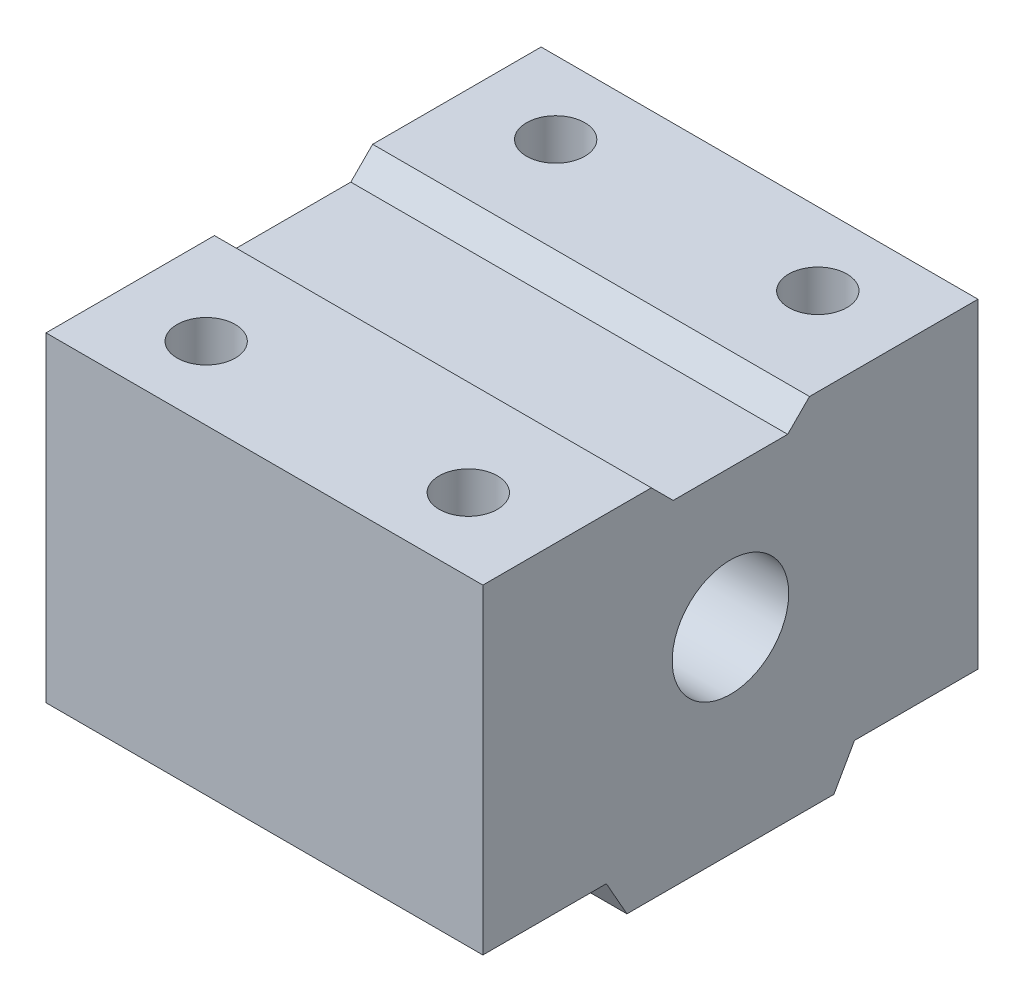
from build123d import *

# Parameters (mm, degrees)
SKETCH1_W             = 30
SKETCH1_H             = 34
BOSS_EXTRUDE1_DEPTH   = 22
F_4_0MM_DOWEL_HOLE1_D = 4
BOSS_EXTRUDE2_DEPTH   = 30
SKETCH5_W             = 30
SKETCH5_H             = 10.861011286
CUT_EXTRUDE1_DEPTH    = 1.5
CHAMFER2_SIZE         = 1.5
CUT_EXTRUDE2_DEPTH    = 41.902322672


with BuildPart() as part:
    # Sketch1 → Boss-Extrude1 (new body)
    with BuildSketch(Plane(origin=(0, 0, 0), x_dir=(1, 0, 0), z_dir=(0, 1, 0))):
        Rectangle(SKETCH1_W, SKETCH1_H)
    extrude(amount=BOSS_EXTRUDE1_DEPTH)

    # Ø4.0mm Dowel Hole1 (through all)
    with Locations(Plane(origin=(0, 22, 0), x_dir=(1, 0, 0), z_dir=(0, 1, 0))):
        with Locations((9, -12), (-9, -12), (9, 12), (-9, 12)):
            Hole(F_4_0MM_DOWEL_HOLE1_D / 2)

    # Sketch4 → Boss-Extrude2 (add, through all)
    with BuildSketch(Plane(origin=(15, 0, 0), x_dir=(0, 0, -1), z_dir=(1, 0, 0))):
        Polygon((-8.519809931, 0), (8.519809931, 0), (7.106209181, -2.5), (-7.106209181, -2.5), align=None)
    extrude(amount=-BOSS_EXTRUDE2_DEPTH)

    # Sketch5 → Cut-Extrude1 (cut)
    with BuildSketch(Plane(origin=(0, 22, 0), x_dir=(1, 0, 0), z_dir=(0, 1, 0))):
        Rectangle(SKETCH5_W, SKETCH5_H)
    extrude(amount=-CUT_EXTRUDE1_DEPTH, mode=Mode.SUBTRACT)

    # Chamfer2
    chamfer2_edges = [part.edges().sort_by_distance(p)[0] for p in [
        (0, 20.5, 5.430505643),
        (0, 20.5, -5.430505643),
    ]]
    chamfer(chamfer2_edges, length=CHAMFER2_SIZE - 0.0001)  # a hair under: the kernel refuses the full size

    # Sketch8 → Cut-Extrude2 (cut, through all)
    with BuildSketch(Plane(origin=(15, 0, 0), x_dir=(0, 0, -1), z_dir=(1, 0, 0))):
        with BuildLine():
            Line((4, 11), (0, 11))
            Line((0, 11), (-4, 11))
            ThreePointArc((-4, 11), (0, 7), (4, 11))
        make_face()
        with BuildLine():
            Line((-4, 11), (0, 11))
            Line((0, 11), (4, 11))
            ThreePointArc((4, 11), (0, 15), (-4, 11))
        make_face()
    extrude(amount=-CUT_EXTRUDE2_DEPTH, mode=Mode.SUBTRACT)


solid = part.part
